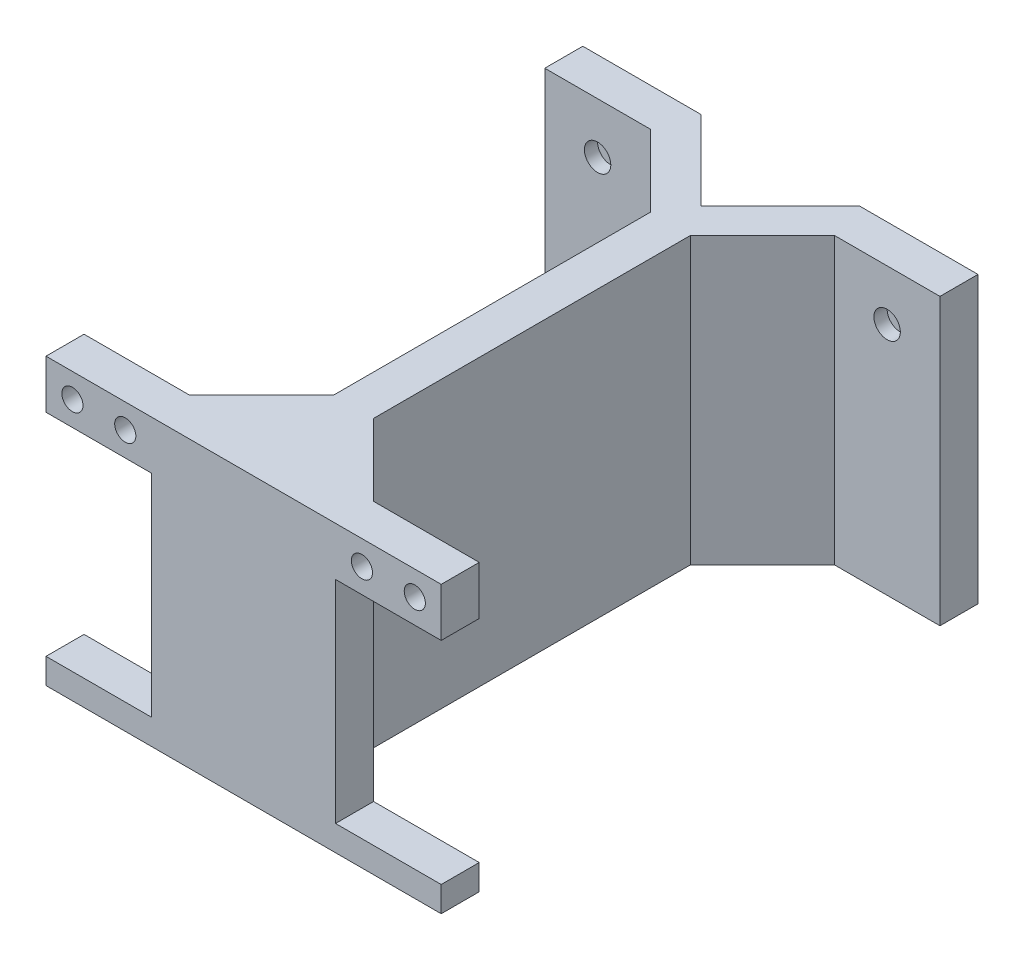
from build123d import *

# Parameters (mm, degrees)
SKETCH2_W           = 74.8
SKETCH2_H           = 54
BOSS_EXTRUDE1_DEPTH = 101.6
CUT_EXTRUDE1_DEPTH  = 101.6
CUT_EXTRUDE2_DEPTH  = 101.6
SKETCH5_W           = 20
SKETCH5_H           = 40
CUT_EXTRUDE3_DEPTH  = 10
SKETCH6_W           = 20
SKETCH6_H           = 40
CUT_EXTRUDE4_DEPTH  = 10
SKETCH7_R           = 2.5
CUT_EXTRUDE5_DEPTH  = 2.5
SKETCH8_R           = 2.5
CUT_EXTRUDE6_DEPTH  = 2.5
CUT_EXTRUDE7_DEPTH  = 123.01452649
SKETCH10_R          = 2
CUT_EXTRUDE8_DEPTH  = 10
SKETCH12_R          = 2
CUT_EXTRUDE9_DEPTH  = 10
SKETCH13_R          = 2
CUT_EXTRUDE10_DEPTH = 10


with BuildPart() as part:
    # Sketch2 → Boss-Extrude1 (new body)
    with BuildSketch(Plane.XY):
        with Locations((-3.207692308, -8.81353022)):
            Rectangle(SKETCH2_W, SKETCH2_H)
    extrude(amount=BOSS_EXTRUDE1_DEPTH)

    # Sketch3 → Cut-Extrude1 (cut)
    with BuildSketch(Plane(origin=(0, 18.18646978, 0), x_dir=(1, 0, 0), z_dir=(0, 1, 0))):
        Polygon((-40.607692308, -7.2), (-20.607692308, -7.2), (-7.007692308, -20.8), (-7.007692308, -80.8), (-20.607692308, -94.4), (-40.607692308, -94.4), align=None)
    extrude(amount=-CUT_EXTRUDE1_DEPTH, mode=Mode.SUBTRACT)

    # Sketch4 → Cut-Extrude2 (cut)
    with BuildSketch(Plane(origin=(0, 18.18646978, 0), x_dir=(1, 0, 0), z_dir=(0, 1, 0))):
        Polygon((34.192307692, -94.4), (14.192307692, -94.4), (0.592307692, -80.8), (0.592307692, -20.8), (14.192307692, -7.2), (34.192307692, -7.2), align=None)
    extrude(amount=-CUT_EXTRUDE2_DEPTH, mode=Mode.SUBTRACT)

    # Sketch5 → Cut-Extrude3 (cut)
    with BuildSketch(Plane.XY.offset(101.6)):
        with Locations((24.192307692, -11.01353022)):
            Rectangle(SKETCH5_W, SKETCH5_H)
    extrude(amount=-CUT_EXTRUDE3_DEPTH, mode=Mode.SUBTRACT)

    # Sketch6 → Cut-Extrude4 (cut)
    with BuildSketch(Plane.XY.offset(101.6)):
        with Locations((-30.607692308, -11.01353022)):
            Rectangle(SKETCH6_W, SKETCH6_H)
    extrude(amount=-CUT_EXTRUDE4_DEPTH, mode=Mode.SUBTRACT)

    # Sketch7 → Cut-Extrude5 (cut)
    with BuildSketch(Plane.XY.offset(7.2)):
        with Locations((24.192307692, 8.58646978)):
            Circle(SKETCH7_R)
    extrude(amount=-CUT_EXTRUDE5_DEPTH, mode=Mode.SUBTRACT)

    # Sketch8 → Cut-Extrude6 (cut)
    with BuildSketch(Plane.XY.offset(7.2)):
        with Locations((-30.607692308, 8.58646978)):
            Circle(SKETCH8_R)
    extrude(amount=-CUT_EXTRUDE6_DEPTH, mode=Mode.SUBTRACT)

    # Sketch9 → Cut-Extrude7 (cut, through all)
    with BuildSketch(Plane(origin=(0, 18.18646978, 0), x_dir=(1, 0, 0), z_dir=(0, 1, 0))):
        Polygon((-18.24818848, 0), (-3.207692308, -15.040496172), (11.832803865, 0), align=None)
    extrude(amount=-CUT_EXTRUDE7_DEPTH, mode=Mode.SUBTRACT)

    # Sketch10 → Cut-Extrude8 (cut)
    with BuildSketch(Plane(origin=(0, 0, 94.4), x_dir=(-1, 0, 0), z_dir=(0, 0, -1))):
        with Locations((-29.192307692, 13.58646978)):
            Circle(SKETCH10_R)
    extrude(amount=-CUT_EXTRUDE8_DEPTH, mode=Mode.SUBTRACT)

    # Sketch12 → Cut-Extrude9 (cut)
    with BuildSketch(Plane(origin=(0, 0, 94.4), x_dir=(-1, 0, 0), z_dir=(0, 0, -1))):
        with Locations((-19.192307692, 13.58646978)):
            Circle(SKETCH12_R)
    extrude(amount=-CUT_EXTRUDE9_DEPTH, mode=Mode.SUBTRACT)

    # Sketch13 → Cut-Extrude10 (cut)
    with BuildSketch(Plane(origin=(0, 0, 94.4), x_dir=(-1, 0, 0), z_dir=(0, 0, -1))):
        with Locations((35.607692308, 13.58646978)):
            Circle(SKETCH13_R)
        with Locations((25.607692308, 13.58646978)):
            Circle(SKETCH13_R)
    extrude(amount=-CUT_EXTRUDE10_DEPTH, mode=Mode.SUBTRACT)


solid = part.part
